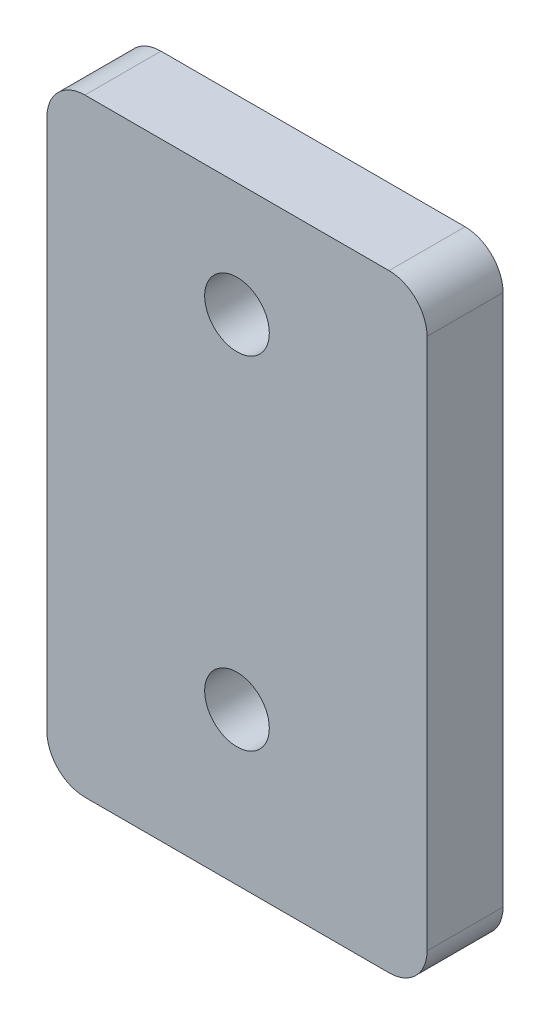
from build123d import *

# Parameters (mm, degrees)
IZIM1_W               = 50
IZIM1_H               = 80
TABAN_FLAN_1_DEPTH    = 10
IZIM6_R               = 4.25
KES_EKSTR_ZYON1_DEPTH = 20
RADYUS1_R             = 5


# Sheet-metal steps are written as plain solids
with BuildPart() as part:
    # Çizim1 → Taban-Flanş1 (new body)
    with BuildSketch(Plane.XY):
        Rectangle(IZIM1_W, IZIM1_H)
    extrude(amount=-TABAN_FLAN_1_DEPTH)

    # Çizim6 → Kes-Ekstrüzyon1 (cut)
    with BuildSketch(Plane.XY):
        with Locations((0, 25)):
            Circle(IZIM6_R)
        with Locations((0, -20)):
            Circle(IZIM6_R)
    extrude(amount=-KES_EKSTR_ZYON1_DEPTH, mode=Mode.SUBTRACT)

    # Radyus1
    radyus1_edges = [part.edges().sort_by_distance(p)[0] for p in [
        (25, -40, -5),
        (-25, -40, -5),
        (-25, 40, -5),
        (25, 40, -5),
    ]]
    fillet(radyus1_edges, radius=RADYUS1_R)


solid = part.part
